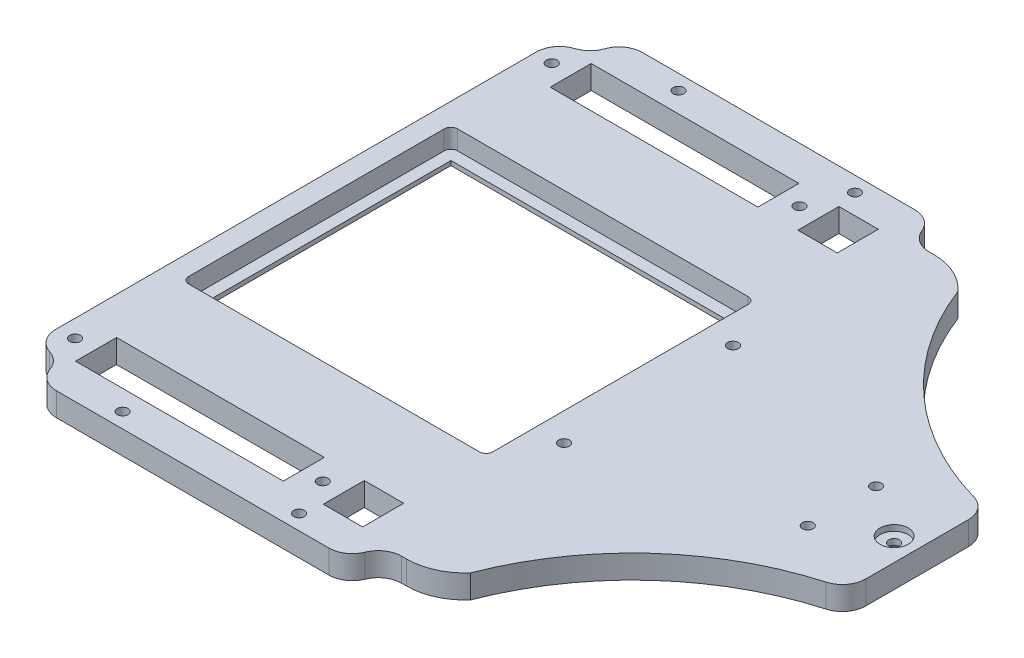
from build123d import *

# Parameters (mm, degrees)
SALIENTE_EXTRUIR1_DEPTH = 8
CROQUIS2_R              = 1.825
CORTAR_EXTRUIR1_DEPTH   = 220.463870727
CROQUIS3_R              = 1.825
CORTAR_EXTRUIR2_DEPTH   = 220.463870727
CROQUIS4_W              = 103.75
CROQUIS4_H              = 91.75
CORTAR_EXTRUIR3_DEPTH   = 6.5
REDONDEO1_R             = 2.3
CROQUIS5_R              = 1.825
CORTAR_EXTRUIR4_DEPTH   = 220.463870727
CROQUIS20_W             = 70.9
CROQUIS20_H             = 14
CROQUIS20_W_2           = 13.452738683
CORTAR_EXTRUIR15_DEPTH  = 220.463870727
CROQUIS6_W              = 95.75
CROQUIS6_H              = 83.75
CORTAR_EXTRUIR5_DEPTH   = 220.414312556
CROQUIS9_R              = 1.825
CORTAR_EXTRUIR7_DEPTH   = 220.463870727
CROQUIS12_W             = 65
CROQUIS12_H             = 180
CORTAR_EXTRUIR9_DEPTH   = 220.463870727
REDONDEO2_R             = 8
CROQUIS14_R             = 1.825
CORTAR_EXTRUIR11_DEPTH  = 220.463870727
CROQUIS15_R             = 4.825
CORTAR_EXTRUIR12_DEPTH  = 2
CROQUIS16_W             = 11
CROQUIS16_H             = 47.47584408
CORTAR_EXTRUIR13_DEPTH  = 220.463870727
REDONDEO3_R             = 8
CROQUIS18_R             = 2.8
CORTAR_EXTRUIR14_DEPTH  = 4
CROQUIS21_W             = 108.962587205
CROQUIS21_H             = 10
SALIENTE_EXTRUIR9_DEPTH = 8
REDONDEO5_R             = 8
REDONDEO6_R             = 8
CROQUIS22_R             = 1.825
CORTAR_EXTRUIR16_DEPTH  = 215.858092703


with BuildPart() as part:
    # Croquis1 → Saliente-Extruir1 (new body)
    with BuildSketch(Plane(origin=(0, 0, 0), x_dir=(1, 0, 0), z_dir=(0, 1, 0))):
        with BuildLine():
            Line((0, 0), (200, 0))
            Line((200, 0), (200, 15.2))
            ThreePointArc((200, 15.2), (197.701163079, 20.938172036), (191.9990235, 23.3249845))
            ThreePointArc((191.9990235, 23.3249845), (148.666739026, 44.032184001), (120.7781513, 83.1307986))
            ThreePointArc((120.7781513, 83.1307986), (113.982057966, 88.196272982), (105.7, 90))
            Line((105.7, 90), (0, 90))
            Line((0, 90), (-79, 90))
            ThreePointArc((-79, 90), (-84.638146896, 87.675499941), (-86.999825594, 82.052824894))
            Line((-86.999825594, 82.052824894), (-86.999825594, 41.494023494))
            Line((-86.999825594, 41.494023494), (-86.999825594, 0))
            Line((-86.999825594, 0), (0, 0))
        make_face()
    extrude(amount=SALIENTE_EXTRUIR1_DEPTH)

    # Simetría2: part across plane


with BuildPart() as part_1:
    add(part.part)
    add(part.part.mirror(Plane(origin=(0, 8, 0), x_dir=(1, 0, 0), z_dir=(0, 0, -1))))

    # Croquis2 → Cortar-Extruir1 (cut, through all)
    with BuildSketch(Plane(origin=(0, 8, 0), x_dir=(1, 0, 0), z_dir=(0, 1, 0))):
        with Locations(Location((68.5, 81.35, 0), (0, 0, 270))):
            Circle(CROQUIS2_R)
        with Locations(Location((-16.05, 81.35, 0), (0, 0, 270))):
            Circle(CROQUIS2_R)
        with Locations(Location((68.5, -81.35, 0), (0, 0, 90))):
            Circle(CROQUIS2_R)
        with Locations(Location((-16.05, -81.35, 0), (0, 0, 90))):
            Circle(CROQUIS2_R)
    extrude(amount=-CORTAR_EXTRUIR1_DEPTH, mode=Mode.SUBTRACT)

    # Croquis3 → Cortar-Extruir2 (cut, through all)
    with BuildSketch(Plane(origin=(0, 8, 0), x_dir=(1, 0, 0), z_dir=(0, 1, 0))):
        with Locations(Location((-76.999825594, -46.75, 0), (0, 0, 270))):
            Circle(CROQUIS3_R)
        with Locations(Location((-34.999825594, -46.75, 0), (0, 0, 270))):
            Circle(CROQUIS3_R)
        with Locations(Location((-34.999825594, 46.75, 0), (0, 0, 90))):
            Circle(CROQUIS3_R)
        with Locations(Location((-76.999825594, 46.75, 0), (0, 0, 90))):
            Circle(CROQUIS3_R)
    extrude(amount=-CORTAR_EXTRUIR2_DEPTH, mode=Mode.SUBTRACT)

    # Croquis4 → Cortar-Extruir3 (cut)
    with BuildSketch(Plane(origin=(0, 8, 0), x_dir=(1, 0, 0), z_dir=(0, 1, 0))):
        with Locations((36.90017441, 0)):
            Rectangle(CROQUIS4_W, CROQUIS4_H)
    extrude(amount=-CORTAR_EXTRUIR3_DEPTH, mode=Mode.SUBTRACT)

    # Redondeo1
    redondeo1_edges = [part_1.edges().sort_by_distance(p)[0] for p in [
        (88.77517441, 4.75, -45.875),
        (88.77517441, 4.75, 45.875),
        (-14.97482559, 4.75, 45.875),
        (-14.97482559, 4.75, -45.875),
    ]]
    fillet(redondeo1_edges, radius=REDONDEO1_R)

    # Croquis5 → Cortar-Extruir4 (cut, through all)
    with BuildSketch(Plane(origin=(0, 8, 0), x_dir=(1, 0, 0), z_dir=(0, 1, 0))):
        with Locations(Location((98.35, 28.84, 0), (0, 0, 270))):
            Circle(CROQUIS5_R)
        with Locations(Location((98.35, -28.84, 0), (0, 0, 90))):
            Circle(CROQUIS5_R)
        with Locations(Location((164.35, 11.66, 0), (0, 0, 270))):
            Circle(CROQUIS5_R)
        with Locations(Location((164.35, -11.66, 0), (0, 0, 90))):
            Circle(CROQUIS5_R)
    extrude(amount=-CORTAR_EXTRUIR4_DEPTH, mode=Mode.SUBTRACT)

    # Croquis20 → Cortar-Extruir15 (cut, through all)
    with BuildSketch(Plane(origin=(0, 8, 0), x_dir=(1, 0, 0), z_dir=(0, 1, 0))):
        with Locations((26.225, -81)):
            Rectangle(CROQUIS20_W, CROQUIS20_H)
        with Locations((82.048805069, -81)):
            Rectangle(CROQUIS20_W_2, CROQUIS20_H)
        with Locations((82.048805069, 81)):
            Rectangle(CROQUIS20_W_2, CROQUIS20_H)
        with Locations((26.225, 81)):
            Rectangle(CROQUIS20_W, CROQUIS20_H)
    extrude(amount=-CORTAR_EXTRUIR15_DEPTH, mode=Mode.SUBTRACT)

    # Croquis6 → Cortar-Extruir5 (cut, through all)
    with BuildSketch(Plane(origin=(0, 1.5, 0), x_dir=(1, 0, 0), z_dir=(0, 1, 0))):
        with Locations((36.90017441, 0)):
            Rectangle(CROQUIS6_W, CROQUIS6_H)
    extrude(amount=-CORTAR_EXTRUIR5_DEPTH, mode=Mode.SUBTRACT)

    # Croquis9 → Cortar-Extruir7 (cut, through all)
    with BuildSketch(Plane(origin=(0, 8, 0), x_dir=(1, 0, 0), z_dir=(0, 1, 0))):
        with Locations(Location((-80.675393895, -75.767215538, 0), (0, 0, 270))):
            Circle(CROQUIS9_R)
        with Locations(Location((-58.52366486, -80.370640978, 0), (0, 0, 270))):
            Circle(CROQUIS9_R)
        with Locations(Location((-58.52366486, 80.370640978, 0), (0, 0, 90))):
            Circle(CROQUIS9_R)
        with Locations(Location((-80.675393895, 75.767215538, 0), (0, 0, 90))):
            Circle(CROQUIS9_R)
    extrude(amount=-CORTAR_EXTRUIR7_DEPTH, mode=Mode.SUBTRACT)

    # Croquis12 → Cortar-Extruir9 (cut, through all)
    with BuildSketch(Plane(origin=(0, 8, 0), x_dir=(1, 0, 0), z_dir=(0, 1, 0))):
        with Locations((-54.499825594, 0)):
            Rectangle(CROQUIS12_W, CROQUIS12_H)
    extrude(amount=-CORTAR_EXTRUIR9_DEPTH, mode=Mode.SUBTRACT)

    # Redondeo2
    redondeo2_edges = [part_1.edges().sort_by_distance(p)[0] for p in [
        (-21.999825594, 4, 90),
        (-21.999825594, 4, -90),
    ]]
    fillet(redondeo2_edges, radius=REDONDEO2_R)

    # Croquis14 → Cortar-Extruir11 (cut, through all)
    with BuildSketch(Plane(origin=(0, 8, 0), x_dir=(1, 0, 0), z_dir=(0, 1, 0))):
        with Locations(Location((182.175, 0, 0), (0, 0, 270))):
            Circle(CROQUIS14_R)
    extrude(amount=-CORTAR_EXTRUIR11_DEPTH, mode=Mode.SUBTRACT)

    # Croquis15 → Cortar-Extruir12 (cut)
    with BuildSketch(Plane(origin=(0, 8, 0), x_dir=(1, 0, 0), z_dir=(0, 1, 0))):
        with Locations(Location((182.175, 0, 0), (0, 0, 270))):
            Circle(CROQUIS15_R)
    extrude(amount=-CORTAR_EXTRUIR12_DEPTH, mode=Mode.SUBTRACT)

    # Croquis16 → Cortar-Extruir13 (cut, through all)
    with BuildSketch(Plane(origin=(0, 8, 0), x_dir=(1, 0, 0), z_dir=(0, 1, 0))):
        with Locations((195.5, 0)):
            Rectangle(CROQUIS16_W, CROQUIS16_H)
    extrude(amount=-CORTAR_EXTRUIR13_DEPTH, mode=Mode.SUBTRACT)

    # Redondeo3
    redondeo3_edges = [part_1.edges().sort_by_distance(p)[0] for p in [
        (190, 4, 23.73792204),
        (190, 4, -23.73792204),
    ]]
    fillet(redondeo3_edges, radius=REDONDEO3_R)

    # Croquis18 → Cortar-Extruir14 (cut)
    with BuildSketch(Plane.XZ):
        with Locations(Location((182.175, 0, 0), (0, 0, 270))):
            Circle(CROQUIS18_R)
    extrude(amount=-CORTAR_EXTRUIR14_DEPTH, mode=Mode.SUBTRACT)

    # Croquis21 → Saliente-Extruir9 (add)
    with BuildSketch(Plane(origin=(0, 8, 0), x_dir=(1, 0, 0), z_dir=(0, 1, 0))):
        with Locations((42.756293603, 95)):
            Rectangle(CROQUIS21_W, CROQUIS21_H)
        with Locations((42.756293603, -95)):
            Rectangle(CROQUIS21_W, CROQUIS21_H)
    extrude(amount=-SALIENTE_EXTRUIR9_DEPTH)

    # Redondeo5
    redondeo5_edges = [part_1.edges().sort_by_distance(p)[0] for p in [
        (-11.725, 4, -100),
        (97.237587205, 4, -100),
        (-11.725, 4, 100),
        (97.237587205, 4, 100),
    ]]
    fillet(redondeo5_edges, radius=REDONDEO5_R)

    # Redondeo6
    # the kernel refuses this fillet: 8 mm, written as the material it adds along each edge
    with BuildSketch(Plane(origin=(-11.725, 8, -90), x_dir=(0.09534974833302788, 0, -0.9954438334194594), z_dir=(0, -1, 0))) as redondeo6_piece_1:
        with BuildLine():
            CenterArc((6.539334701, -7.772851171), REDONDEO6_R, 103.686136853, 53.238021041)
            Line((-0.820560007, -4.637257147), (-1.556549478, -4.323697744))
            ThreePointArc((-1.556549478, -4.323697744), (-1.013259115, -2.188181311), (-0.796355067, 0.076279799))
            Line((-0.796355067, 0.076279799), (0.076279799, 0.796355067))
            ThreePointArc((0.076279799, 0.796355067), (2.067167466, 0.60565557), (4.457227725, 0.777285117))
            Line((4.457227725, 0.777285117), (4.646510177, 0))
        make_face()
    extrude(amount=8)
    with BuildSketch(Plane(origin=(97.237587205, 8, -90), x_dir=(-0.11597245427471743, 0, -0.9932524300748017), z_dir=(0, -1, 0))) as redondeo6_piece_2:
        with BuildLine():
            CenterArc((7.153649595, 7.714074532), REDONDEO6_R, 186.659717889, 67.975687163)
            Line((-0.792369846, 6.786294898), (-1.58697179, 6.693516934))
            Line((-1.58697179, 6.693516934), (-0.794601944, -0.092777963))
            Line((-0.794601944, -0.092777963), (0.092777963, -0.794601944))
            ThreePointArc((0.092777963, -0.794601944), (2.079282824, -0.562657036), (4.82199879, -0.771407453))
            Line((4.82199879, -0.771407453), (5.033967045, 0))
        make_face()
    extrude(amount=8)
    with BuildSketch(Plane(origin=(-11.725, 8, 90), x_dir=(-0.996830274314205, 0, -0.07955755281974515), z_dir=(0, -1, 0))) as redondeo6_piece_3:
        with BuildLine():
            CenterArc((6.514517354, -7.793662637), REDONDEO6_R, 103.04125749, 53.238021041)
            Line((-0.809619973, -4.575431382), (-1.542033706, -4.253608256))
            ThreePointArc((-1.542033706, -4.253608256), (-0.956579325, -1.930014506), (-0.797464219, 0.063646042))
            Line((-0.797464219, 0.063646042), (0.063646042, 0.797464219))
            ThreePointArc((0.063646042, 0.797464219), (2.331261063, 0.616484662), (4.528774303, 0.779366264))
            Line((4.528774303, 0.779366264), (4.709296399, 0))
        make_face()
    extrude(amount=8)
    with BuildSketch(Plane(origin=(97.237587205, 8, 90), x_dir=(1, 0, 0), z_dir=(0, -1, 0))) as redondeo6_piece_4:
        with BuildLine():
            CenterArc((6.832396974, 8), REDONDEO6_R, 202.024312837, 67.975687163)
            Line((-0.583801513, 5), (-1.325421362, 4.7))
            ThreePointArc((-1.325421362, 4.7), (-0.8, 2), (-0.8, 0))
            Line((-0.8, 0), (0, -0.8))
            Line((0, -0.8), (6.832396974, -0.8))
            Line((6.832396974, -0.8), (6.832396974, 0))
        make_face()
    extrude(amount=8)
    # the kernel refuses this fillet: 8 mm, written as the material it takes off along each edge

    # Croquis22 → Cortar-Extruir16 (cut, through all)
    with BuildSketch(Plane(origin=(0, 8, 0), x_dir=(1, 0, 0), z_dir=(0, 1, 0))):
        with Locations(Location((13.703094373, 94.859502658, 0), (0, 0, 270))):
            Circle(CROQUIS22_R)
        with Locations(Location((73.947520586, 94.859502658, 0), (0, 0, 90))):
            Circle(CROQUIS22_R)
        with Locations(Location((73.947520586, -94.859502658, 0), (0, 0, 270))):
            Circle(CROQUIS22_R)
        with Locations(Location((13.703094373, -94.859502658, 0), (0, 0, 90))):
            Circle(CROQUIS22_R)
    extrude(amount=-CORTAR_EXTRUIR16_DEPTH, mode=Mode.SUBTRACT)


solid = part_1.part
